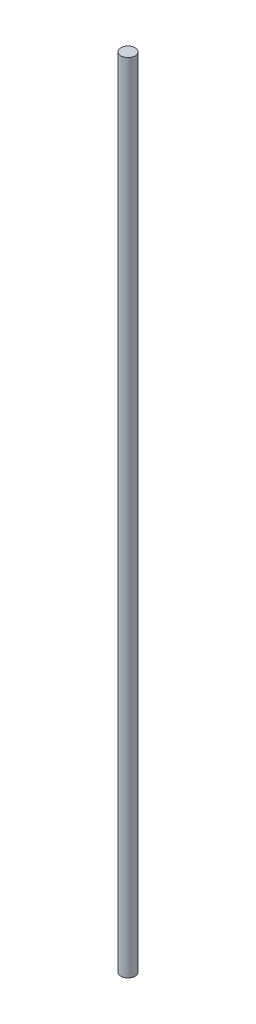
from build123d import *

# Parameters (mm, degrees)
SKETCH2_R           = 4
BOSS_EXTRUDE1_DEPTH = 450


with BuildPart() as part:
    # Sketch2 → Boss-Extrude1 (new body)
    with BuildSketch(Plane(origin=(0, 0, 0), x_dir=(1, 0, 0), z_dir=(0, 1, 0))):
        Circle(SKETCH2_R)
    extrude(amount=BOSS_EXTRUDE1_DEPTH)


solid = part.part
